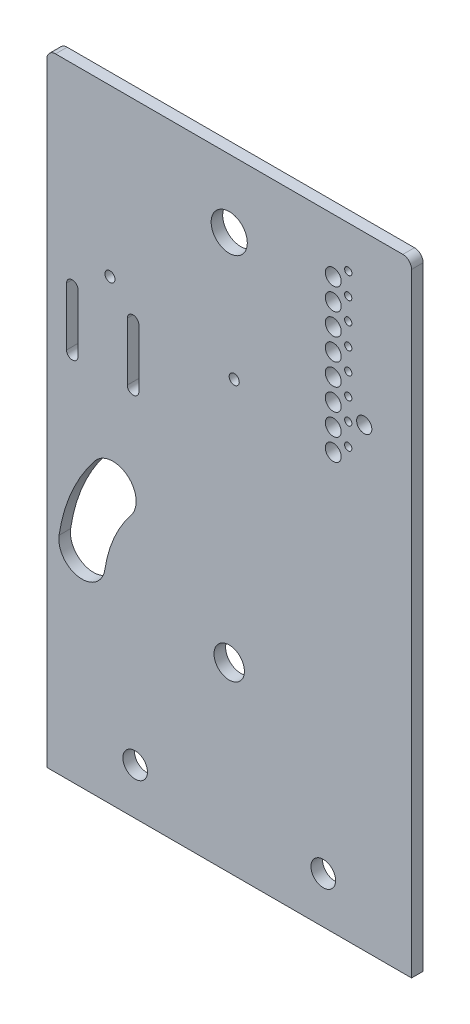
from build123d import *

# Parameters (mm, degrees)
MODEL_W               = 126
MODEL_H               = 215
MODEL_R               = 4.5
MODEL_R_2             = 6.25
MODEL_R_3             = 5.25
MODEL_R_4             = 2.750009003
MODEL_R_5             = 1.25
MODEL_R_6             = 2.625
MODEL_R_7             = 1.75
TABAN_FLAN_1_DEPTH    = 4
IZIM1_W               = 102.176444729
IZIM1_H               = 22.108353538
SEKME1_DEPTH          = 4
IZIM4_R               = 4.25
KES_EKSTR_ZYON1_DEPTH = 10
KES_EKSTR_ZYON2_DEPTH = 10
KES_EKSTR_ZYON4_DEPTH = 10
RADYUS1_R             = 3


# Sheet-metal steps are written as plain solids
with BuildPart() as part:
    # Model → Taban-Flanş1 (new body)
    with BuildSketch(Plane.XY):
        with Locations((2161.892923165, 1693.121210327)):
            Rectangle(MODEL_W, MODEL_H)
        with Locations((2129.437918581, 1602.511715112)):
            Circle(MODEL_R, mode=Mode.SUBTRACT)
        with Locations((2194.437918581, 1602.511715112)):
            Circle(MODEL_R, mode=Mode.SUBTRACT)
        with Locations((2161.892918569, 1777.197615102)):
            Circle(MODEL_R_2, mode=Mode.SUBTRACT)
        with Locations((2161.892918569, 1648.515095807)):
            Circle(MODEL_R_3, mode=Mode.SUBTRACT)
        with Locations((2197.838423148, 1781.897610313)):
            Circle(MODEL_R_4, mode=Mode.SUBTRACT)
        with Locations((2203.017232274, 1786.156601204)):
            Circle(MODEL_R_5, mode=Mode.SUBTRACT)
        with Locations((2197.833609474, 1774.397615119)):
            Circle(MODEL_R_4, mode=Mode.SUBTRACT)
        with Locations((2203.012418599, 1778.65660601)):
            Circle(MODEL_R_5, mode=Mode.SUBTRACT)
        with Locations((2197.834704915, 1766.897610313)):
            Circle(MODEL_R_4, mode=Mode.SUBTRACT)
        with Locations((2203.013514041, 1771.156601204)):
            Circle(MODEL_R_5, mode=Mode.SUBTRACT)
        with Locations((2197.834104915, 1759.397610313)):
            Circle(MODEL_R_4, mode=Mode.SUBTRACT)
        with Locations((2203.012914041, 1763.656601204)):
            Circle(MODEL_R_5, mode=Mode.SUBTRACT)
        with Locations((2197.835304915, 1751.897610313)):
            Circle(MODEL_R_4, mode=Mode.SUBTRACT)
        with Locations((2203.014114041, 1756.156601204)):
            Circle(MODEL_R_5, mode=Mode.SUBTRACT)
        with Locations((2197.836004915, 1744.397610313)):
            Circle(MODEL_R_4, mode=Mode.SUBTRACT)
        with Locations((2203.014814041, 1748.656601204)):
            Circle(MODEL_R_5, mode=Mode.SUBTRACT)
        with Locations((2197.833623148, 1736.897610313)):
            Circle(MODEL_R_4, mode=Mode.SUBTRACT)
        with Locations((2203.012432274, 1741.156601204)):
            Circle(MODEL_R_5, mode=Mode.SUBTRACT)
        with Locations((2197.833623148, 1729.397610313)):
            Circle(MODEL_R_4, mode=Mode.SUBTRACT)
        with Locations((2203.012432274, 1733.656601204)):
            Circle(MODEL_R_5, mode=Mode.SUBTRACT)
        with Locations((2208.53221406, 1742.933219427)):
            Circle(MODEL_R_6, mode=Mode.SUBTRACT)
        with Locations((2163.619323241, 1734.111700763)):
            Circle(MODEL_R_7, mode=Mode.SUBTRACT)
        with Locations((2120.695323241, 1743.382400763)):
            Circle(MODEL_R_7, mode=Mode.SUBTRACT)
    extrude(amount=-TABAN_FLAN_1_DEPTH)

    # Çizim1 → Sekme1 (add)
    with BuildSketch(Plane.XY):
        with Locations((2155.462798754, 1603.699676968)):
            Rectangle(IZIM1_W, IZIM1_H)
    extrude(amount=-SEKME1_DEPTH)

    # Çizim4 → Kes-Ekstrüzyon1 (cut)
    with BuildSketch(Plane.XY):
        with Locations((2129.392923165, 1601.621210327)):
            Circle(IZIM4_R)
        with Locations((2194.392923165, 1601.621210327)):
            Circle(IZIM4_R)
    extrude(amount=-KES_EKSTR_ZYON1_DEPTH, mode=Mode.SUBTRACT)

    # Çizim7 → Kes-Ekstrüzyon2 (cut)
    with BuildSketch(Plane.XY):
        with BuildLine():
            ThreePointArc((2115.489264274, 1685.628682491), (2107.413399384, 1672.236382403), (2103.111338467, 1657.20090545))
            ThreePointArc((2103.111338467, 1657.20090545), (2109.85599076, 1648.117422338), (2118.939473872, 1654.862074631))
            ThreePointArc((2118.939473872, 1654.862074631), (2122.083117431, 1665.848943761), (2127.984391527, 1675.635094799))
            ThreePointArc((2127.984391527, 1675.635094799), (2126.733621746, 1686.879452271), (2115.489264274, 1685.628682491))
        make_face()
    extrude(amount=-KES_EKSTR_ZYON2_DEPTH, mode=Mode.SUBTRACT)

    # Çizim9 → Kes-Ekstrüzyon4 (cut)
    with BuildSketch(Plane.XY):
        with BuildLine():
            Line((2109.684510436, 1733.919137473), (2109.684510436, 1713.919137473))
            ThreePointArc((2109.684510436, 1713.919137473), (2107.684510436, 1711.919137473), (2105.684510436, 1713.919137473))
            Line((2105.684510436, 1713.919137473), (2105.684510436, 1733.919137473))
            ThreePointArc((2105.684510436, 1733.919137473), (2107.684510436, 1735.919137473), (2109.684510436, 1733.919137473))
        make_face()
        with BuildLine():
            Line((2130.684510436, 1733.919137473), (2130.684510436, 1713.919137473))
            ThreePointArc((2130.684510436, 1713.919137473), (2128.684510436, 1711.919137473), (2126.684510436, 1713.919137473))
            Line((2126.684510436, 1713.919137473), (2126.684510436, 1733.919137473))
            ThreePointArc((2126.684510436, 1733.919137473), (2128.684510436, 1735.919137473), (2130.684510436, 1733.919137473))
        make_face()
    extrude(amount=-KES_EKSTR_ZYON4_DEPTH, mode=Mode.SUBTRACT)

    # Radyus1
    radyus1_edges = [part.edges().sort_by_distance(p)[0] for p in [
        (2098.892923165, 1800.621210327, -2),
        (2224.892923165, 1800.621210327, -2),
    ]]
    fillet(radyus1_edges, radius=RADYUS1_R)


solid = part.part
